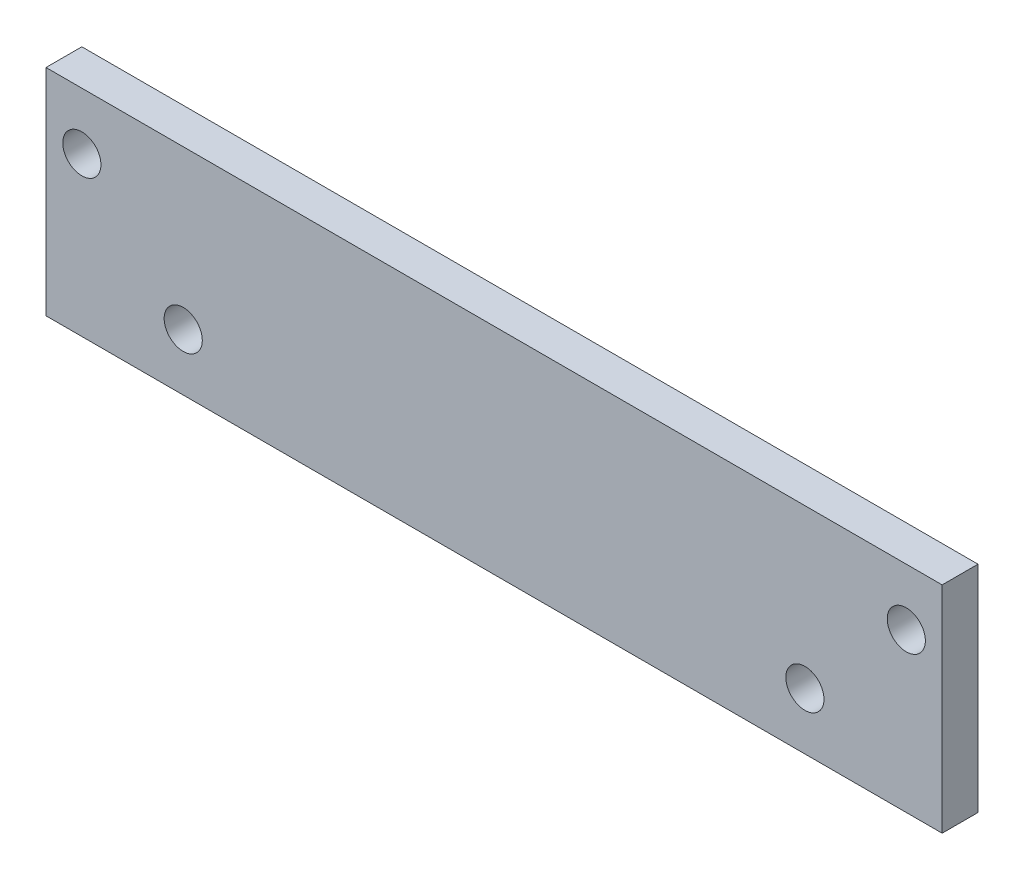
from build123d import *

# Parameters (mm, degrees)
SKETCH1_W               = 158.75
SKETCH1_H               = 38.1
BOSS_EXTRUDE1_DEPTH     = 6.35
F_1_4_CLEARANCE_HOLE1_D = 6.7564


with BuildPart() as part:
    # Sketch1 → Boss-Extrude1 (new body)
    with BuildSketch(Plane.XY):
        Rectangle(SKETCH1_W, SKETCH1_H)
    extrude(amount=BOSS_EXTRUDE1_DEPTH)

    # 1/4 Clearance Hole1 (through all)
    with Locations(Plane.XY.offset(6.35)):
        with Locations((-73.025, 8.980256121), (-55.064487758, -8.980256121)):
            f_1_4_clearance_hole1 = Hole(F_1_4_CLEARANCE_HOLE1_D / 2)

    # Mirror1: 1/4 Clearance Hole1 across plane
    add(f_1_4_clearance_hole1.mirror(Plane(origin=(0, 0, 0), x_dir=(0, 0, 1), z_dir=(1, 0, 0))), mode=Mode.SUBTRACT)


solid = part.part
